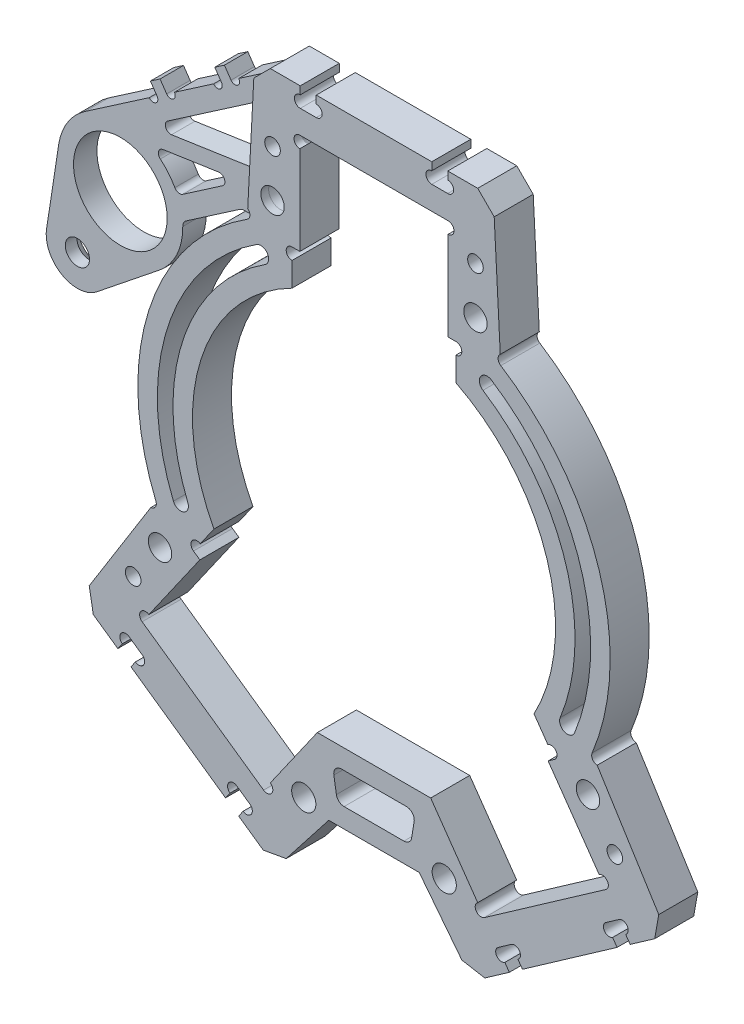
from build123d import *

# Parameters (mm, degrees)
F_5MM_START         = -2.5
F_5MM_OUTLINE_R     = 1.55
F_5MM_OUTLINE_R_2   = 1
F_5MM_OUTLINE_R_3   = 1.5
F_5MM_DEPTH         = 5
SKETCH_3_R          = 1
SKETCH_3_R_2        = 1.5
SKETCH_3_R_3        = 6
EXTRUDE_1_DEPTH     = 1.5
CUT_EXTRUDE_1_DEPTH = 61.418854336
EXTRUDE_2_DEPTH     = 3
FILLET_1_R          = 0.7
FILLET_2_R          = 1
EXTRUDE_3_DEPTH     = 3
SKETCH_8_R          = 1.55
CUT_EXTRUDE_2_DEPTH = 62.458831418
CHAMFER_2_SIZE      = 1.5
EXTRUDE_4_DEPTH     = 3
SKETCH_11_R         = 0.6
CUT_EXTRUDE_3_DEPTH = 62.458831418


# Read off the part's stored shape, not the designer's step: 三角滚珠轨道连接板（中）_5mm
with BuildPart() as part:
    # 三角滚珠轨道连接板（中）_5mm outline → 三角滚珠轨道连接板（中）_5mm (new body)
    with BuildSketch(Plane.XY.offset(F_5MM_START)):
        with BuildLine():
            Line((5.796130384, -35.93416405), (11.257076763, -42.923856671))
            Line((11.257076763, -42.923856671), (14.196586924, -43.442171622))
            Line((14.196586924, -43.442171622), (17.340691348, -41.240646003))
            Line((17.340691348, -41.240646003), (16.767114912, -40.421493959))
            ThreePointArc((16.767114912, -40.421493959), (15.722568551, -40.237312253), (15.906750257, -39.192765892))
            Line((15.906750257, -39.192765892), (17.586011948, -38.016934198))
            ThreePointArc((17.586011948, -38.016934198), (18.630558309, -38.201115903), (18.446376603, -39.245662264))
            Line((18.446376603, -39.245662264), (19.019953039, -40.064814309))
            Line((19.019953039, -40.064814309), (31.143403294, -31.575883051))
            Line((31.143403294, -31.575883051), (30.569826858, -30.756731006))
            ThreePointArc((30.569826858, -30.756731006), (29.525280498, -30.5725493), (29.709462204, -29.52800294))
            Line((29.709462204, -29.52800294), (31.388723894, -28.352171245))
            ThreePointArc((31.388723894, -28.352171245), (32.433270255, -28.536352951), (32.249088549, -29.580899312))
            Line((32.249088549, -29.580899312), (32.822664985, -30.400051356))
            Line((32.822664985, -30.400051356), (35.96676941, -28.198525737))
            Line((35.96676941, -28.198525737), (36.485084361, -25.259015576))
            Line((36.485084361, -25.259015576), (28.594617596, -12.631629161))
            ThreePointArc((28.594617596, -12.631629161), (28.003923126, -12.280440438), (27.947220205, -11.595576762))
            ThreePointArc((27.947220205, -11.595576762), (28.856904848, 9.098547149), (16.242072966, 25.52840738))
            ThreePointArc((16.242072966, 25.52840738), (15.895699614, 26.12193832), (16.17813462, 26.748423709))
            Line((16.17813462, 26.748423709), (15.398855301, 41.617958914))
            Line((15.398855301, 41.617958914), (13.288242786, 43.728571429))
            Line((13.288242786, 43.728571429), (9.45, 43.728571429))
            Line((9.45, 43.728571429), (9.45, 42.728571429))
            ThreePointArc((9.45, 42.728571429), (10.2, 41.978571429), (9.45, 41.228571429))
            Line((9.45, 41.228571429), (7.4, 41.228571429))
            ThreePointArc((7.4, 41.228571429), (6.65, 41.978571429), (7.4, 42.728571429))
            Line((7.4, 42.728571429), (7.4, 43.728571429))
            Line((7.4, 43.728571429), (-7.4, 43.728571429))
            Line((-7.4, 43.728571429), (-7.4, 42.728571429))
            ThreePointArc((-7.4, 42.728571429), (-6.65, 41.978571429), (-7.4, 41.228571429))
            Line((-7.4, 41.228571429), (-9.45, 41.228571429))
            ThreePointArc((-9.45, 41.228571429), (-10.2, 41.978571429), (-9.45, 42.728571429))
            Line((-9.45, 42.728571429), (-9.45, 43.728571429))
            Line((-9.45, 43.728571429), (-13.288242786, 43.728571429))
            Line((-13.288242786, 43.728571429), (-15.398855301, 41.617958914))
            Line((-15.398855301, 41.617958914), (-16.17813462, 26.748423709))
            ThreePointArc((-16.17813462, 26.748423709), (-15.895699614, 26.12193832), (-16.242072966, 25.52840738))
            ThreePointArc((-16.242072966, 25.52840738), (-28.856904848, 9.098547149), (-27.947220205, -11.595576762))
            ThreePointArc((-27.947220205, -11.595576762), (-28.003923126, -12.280440438), (-28.594617596, -12.631629161))
            Line((-28.594617596, -12.631629161), (-36.485084361, -25.259015576))
            Line((-36.485084361, -25.259015576), (-35.96676941, -28.198525737))
            Line((-35.96676941, -28.198525737), (-32.822664985, -30.400051356))
            Line((-32.822664985, -30.400051356), (-32.249088549, -29.580899312))
            ThreePointArc((-32.249088549, -29.580899312), (-32.433270255, -28.536352951), (-31.388723894, -28.352171245))
            Line((-31.388723894, -28.352171245), (-29.709462204, -29.52800294))
            ThreePointArc((-29.709462204, -29.52800294), (-29.525280498, -30.5725493), (-30.569826858, -30.756731006))
            Line((-30.569826858, -30.756731006), (-31.143403294, -31.575883051))
            Line((-31.143403294, -31.575883051), (-19.019953039, -40.064814309))
            Line((-19.019953039, -40.064814309), (-18.446376603, -39.245662264))
            ThreePointArc((-18.446376603, -39.245662264), (-18.630558309, -38.201115903), (-17.586011948, -38.016934198))
            Line((-17.586011948, -38.016934198), (-15.906750257, -39.192765892))
            ThreePointArc((-15.906750257, -39.192765892), (-15.722568551, -40.237312253), (-16.767114912, -40.421493959))
            Line((-16.767114912, -40.421493959), (-17.340691348, -41.240646003))
            Line((-17.340691348, -41.240646003), (-14.196586924, -43.442171622))
            Line((-14.196586924, -43.442171622), (-11.257076763, -42.923856671))
            Line((-11.257076763, -42.923856671), (-5.796130384, -35.93416405))
            Line((-5.796130384, -35.93416405), (5.796130384, -35.93416405))
        make_face()
        with Locations((-9, -35)):
            Circle(F_5MM_OUTLINE_R, mode=Mode.SUBTRACT)
        with Locations((-30.855255033, -21.401062631)):
            Circle(F_5MM_OUTLINE_R_2, mode=Mode.SUBTRACT)
        with Locations((-27.413796415, -16.486150365)):
            Circle(F_5MM_OUTLINE_R_3, mode=Mode.SUBTRACT)
        with Locations((9, -35)):
            Circle(F_5MM_OUTLINE_R, mode=Mode.SUBTRACT)
        with BuildLine():
            Line((-4.159079319, -29.43416405), (4.159079319, -29.43416405))
            ThreePointArc((4.159079319, -29.43416405), (4.920909908, -29.786387736), (5.146070941, -30.594935743))
            Line((5.146070941, -30.594935743), (4.820289669, -32.594935743))
            ThreePointArc((4.820289669, -32.594935743), (4.481074361, -33.195994639), (3.833298046, -33.43416405))
            Line((3.833298046, -33.43416405), (-3.833298046, -33.43416405))
            ThreePointArc((-3.833298046, -33.43416405), (-4.481074361, -33.195994639), (-4.820289669, -32.594935743))
            Line((-4.820289669, -32.594935743), (-5.146070941, -30.594935743))
            ThreePointArc((-5.146070941, -30.594935743), (-4.920909908, -29.786387736), (-4.159079319, -29.43416405))
        make_face(mode=Mode.SUBTRACT)
        with Locations((30.855255033, -21.401062631)):
            Circle(F_5MM_OUTLINE_R_2, mode=Mode.SUBTRACT)
        with Locations((27.413796415, -16.486150365)):
            Circle(F_5MM_OUTLINE_R_3, mode=Mode.SUBTRACT)
        with BuildLine():
            ThreePointArc((-15.041908084, 23.328287396), (-13.65956224, 23.02975772), (-13.958091916, 21.647411876))
            ThreePointArc((-13.958091916, 21.647411876), (-24.565178569, 7.745371051), (-23.850244887, -9.726489073))
            ThreePointArc((-23.850244887, -9.726489073), (-24.398584697, -11.030070084), (-25.702165708, -10.481730275))
            ThreePointArc((-25.702165708, -10.481730275), (-26.472612471, 8.346782651), (-15.041908084, 23.328287396))
        make_face(mode=Mode.SUBTRACT)
        with Locations((-13, 29.228571429)):
            Circle(F_5MM_OUTLINE_R_3, mode=Mode.SUBTRACT)
        with Locations((-13, 35.228571429)):
            Circle(F_5MM_OUTLINE_R_2, mode=Mode.SUBTRACT)
        with BuildLine():
            Line((-10.5, 25.328571429), (-9.5, 25.328571429))
            Line((-9.5, 25.328571429), (-9.5, 36.728571429))
            ThreePointArc((-9.5, 36.728571429), (-10.25, 37.478571429), (-9.5, 38.228571429))
            Line((-9.5, 38.228571429), (9.5, 38.228571429))
            ThreePointArc((9.5, 38.228571429), (10.25, 37.478571429), (9.5, 36.728571429))
            Line((9.5, 36.728571429), (9.5, 25.328571429))
            Line((9.5, 25.328571429), (10.5, 25.328571429))
            ThreePointArc((10.5, 25.328571429), (11.25, 24.578571429), (10.5, 23.828571429))
            Line((10.5, 23.828571429), (10.5, 20.752162415))
            ThreePointArc((10.5, 20.752162415), (22.180886192, 6.993606553), (20.50404783, -10.976623684))
            Line((20.50404783, -10.976623684), (22.268603548, -13.496670417))
            ThreePointArc((22.268603548, -13.496670417), (23.313149909, -13.680852122), (23.128968203, -14.725398483))
            Line((23.128968203, -14.725398483), (22.309816159, -15.298974919))
            Line((22.309816159, -15.298974919), (28.848587533, -24.637308224))
            ThreePointArc((28.848587533, -24.637308224), (29.893133893, -24.82148993), (29.708952188, -25.866036291))
            Line((29.708952188, -25.866036291), (14.145063346, -36.763988581))
            ThreePointArc((14.145063346, -36.763988581), (13.100516986, -36.579806875), (13.284698692, -35.535260515))
            Line((13.284698692, -35.535260515), (7.26214611, -26.93416405))
            Line((7.26214611, -26.93416405), (-7.26214611, -26.93416405))
            Line((-7.26214611, -26.93416405), (-13.284698692, -35.535260515))
            ThreePointArc((-13.284698692, -35.535260515), (-13.100516986, -36.579806875), (-14.145063346, -36.763988581))
            Line((-14.145063346, -36.763988581), (-29.708952188, -25.866036291))
            ThreePointArc((-29.708952188, -25.866036291), (-29.893133893, -24.82148993), (-28.848587533, -24.637308224))
            Line((-28.848587533, -24.637308224), (-22.309816159, -15.298974919))
            Line((-22.309816159, -15.298974919), (-23.128968203, -14.725398483))
            ThreePointArc((-23.128968203, -14.725398483), (-23.313149909, -13.680852122), (-22.268603548, -13.496670417))
            Line((-22.268603548, -13.496670417), (-20.50404783, -10.976623684))
            ThreePointArc((-20.50404783, -10.976623684), (-22.180886192, 6.993606553), (-10.5, 20.752162415))
            Line((-10.5, 20.752162415), (-10.5, 23.828571429))
            ThreePointArc((-10.5, 23.828571429), (-11.25, 24.578571429), (-10.5, 25.328571429))
        make_face(mode=Mode.SUBTRACT)
        with BuildLine():
            ThreePointArc((13.958091916, 21.647411876), (13.65956224, 23.02975772), (15.041908084, 23.328287396))
            ThreePointArc((15.041908084, 23.328287396), (26.472612471, 8.346782651), (25.702165708, -10.481730275))
            ThreePointArc((25.702165708, -10.481730275), (24.398584697, -11.030070084), (23.850244887, -9.726489073))
            ThreePointArc((23.850244887, -9.726489073), (24.565178569, 7.745371051), (13.958091916, 21.647411876))
        make_face(mode=Mode.SUBTRACT)
        with Locations((13, 29.228571429)):
            Circle(F_5MM_OUTLINE_R_3, mode=Mode.SUBTRACT)
        with Locations((13, 35.228571429)):
            Circle(F_5MM_OUTLINE_R_2, mode=Mode.SUBTRACT)
    extrude(amount=F_5MM_DEPTH)


with BuildPart() as body_2:
    # 草图3 → 凸台-拉伸1 (new, symmetric)
    with BuildSketch(Plane.XY):
        with BuildLine():
            Line((-9.5, 36.728571429), (-9.5, 25.328571429))
            Line((-9.5, 25.328571429), (-17.931760303, 25.328571429))
            Line((-17.931760303, 25.328571429), (-25.524101589, 20.120519571))
            ThreePointArc((-25.524101589, 20.120519571), (-36.950563493, 12.282409573), (-38.025334917, 26.097070856))
            Line((-38.025334917, 26.097070856), (-15.398855301, 41.617958914))
            Line((-15.398855301, 41.617958914), (-10.236980663, 37.339433002))
            ThreePointArc((-10.236980663, 37.339433002), (-9.978615806, 36.901140125), (-9.5, 36.728571429))
        make_face()
        with Locations((-13, 35.228571429)):
            Circle(SKETCH_3_R, mode=Mode.SUBTRACT)
        with Locations((-13, 29.228571429)):
            Circle(SKETCH_3_R_2, mode=Mode.SUBTRACT)
        with Locations((-33.5, 19.5)):
            Circle(SKETCH_3_R_3, mode=Mode.SUBTRACT)
    extrude(amount=EXTRUDE_1_DEPTH, both=True)

    # 草图4 → 切除-拉伸1 (cut, through all)
    with BuildSketch(Plane.XY.offset(1.5)):
        with BuildLine():
            Line((-15.56366202, 38.473259387), (-16.025120832, 29.668100713))
            Line((-16.025120832, 29.668100713), (-26.171430518, 22.70812552))
            ThreePointArc((-26.171430518, 22.70812552), (-28.439592185, 25.696149833), (-31.820477963, 27.321713733))
            Line((-31.820477963, 27.321713733), (-15.56366202, 38.473259387))
        make_face()
    extrude(amount=-CUT_EXTRUDE_1_DEPTH, mode=Mode.SUBTRACT)

    # 草图5 → 凸台-拉伸2 (add)
    with BuildSketch(Plane.XY.offset(1.5)):
        with BuildLine():
            Line((-29.826844565, 26.606893073), (-17.906308933, 28.377678587))
            Line((-17.906308933, 28.377678587), (-16.025120832, 29.668100713))
            Line((-16.025120832, 29.668100713), (-15.971722256, 30.687006247))
            Line((-15.971722256, 30.687006247), (-29.939289862, 28.612135859))
            Line((-29.939289862, 28.612135859), (-31.820477963, 27.321713733))
            ThreePointArc((-31.820477963, 27.321713733), (-30.799901636, 27.030568958), (-29.826844565, 26.606893073))
        make_face()
    extrude(amount=-EXTRUDE_2_DEPTH)

    # 圆角1
    fillet_1_edges = [body_2.edges().sort_by_distance(p)[0] for p in [
        (-15.56366202, 38.473259387, 0),
        (-26.171430518, 22.70812552, 0),
        (-29.939289862, 28.612135859, 0),
        (-15.971722256, 30.687006247, 0),
        (-17.906308933, 28.377678587, 0),
        (-29.826844565, 26.606893073, 0),
    ]]
    fillet(fillet_1_edges, radius=FILLET_1_R)

    # 圆角2
    fillet_2_edges = [body_2.edges().sort_by_distance(p)[0] for p in [
        (-9.5, 25.328571429, 0),
        (-17.931760303, 25.328571429, 0),
        (-25.524101589, 20.120519571, 0),
    ]]
    fillet(fillet_2_edges, radius=FILLET_2_R)

    # 草图9 → 凸台-拉伸3 (add)
    with BuildSketch(Plane.XY.offset(1.5)):
        with BuildLine():
            Line((-41.408450672, 20.706817286), (-42.954225336, 10.577129201))
            ThreePointArc((-42.954225336, 10.577129201), (-41, 6.509618943), (-36.500320118, 6.850965286))
            Line((-36.500320118, 6.850965286), (-28.500640237, 13.254489456))
            ThreePointArc((-28.500640237, 13.254489456), (-37.5, 12.57179677), (-41.408450672, 20.706817286))
        make_face()
    extrude(amount=-EXTRUDE_3_DEPTH)

    # 草图8 → 切除-拉伸2 (cut, through all)
    with BuildSketch(Plane.XY.offset(1.5)):
        with Locations((-39, 9.973720558)):
            Circle(SKETCH_8_R)
    extrude(amount=-CUT_EXTRUDE_2_DEPTH, mode=Mode.SUBTRACT)

    # 倒角2
    chamfer_2_edges = [body_2.edges().sort_by_distance(p)[0] for p in [
        (-40.55, 9.973720558, -1.5),
    ]]
    chamfer(chamfer_2_edges, length=CHAMFER_2_SIZE)

    # 草图10 → 凸台-拉伸4 (add)
    with BuildSketch(Plane.XY.offset(1.5)):
        Polygon((-20.552816907, 38.082541009), (-21.401317204, 39.319491795), (-20.164366419, 40.167992092), (-19.315866122, 38.931041306), align=None)
        Polygon((-29.647655775, 33.662823148), (-28.799155478, 32.425872363), (-27.562204692, 33.27437266), (-28.410704989, 34.511323445), align=None)
    extrude(amount=-EXTRUDE_4_DEPTH)

    # 草图11 → 切除-拉伸3 (cut, through all)
    with BuildSketch(Plane.XY.offset(1.5)):
        with Locations((-29.293935792, 32.086472244)):
            Circle(SKETCH_11_R)
        with Locations((-27.067424378, 33.613772778)):
            Circle(SKETCH_11_R)
        with Locations((-21.047597222, 37.743140891)):
            Circle(SKETCH_11_R)
        with Locations((-18.821085808, 39.270441425)):
            Circle(SKETCH_11_R)
    extrude(amount=-CUT_EXTRUDE_3_DEPTH, mode=Mode.SUBTRACT)


solid = Compound([part.part, body_2.part])
